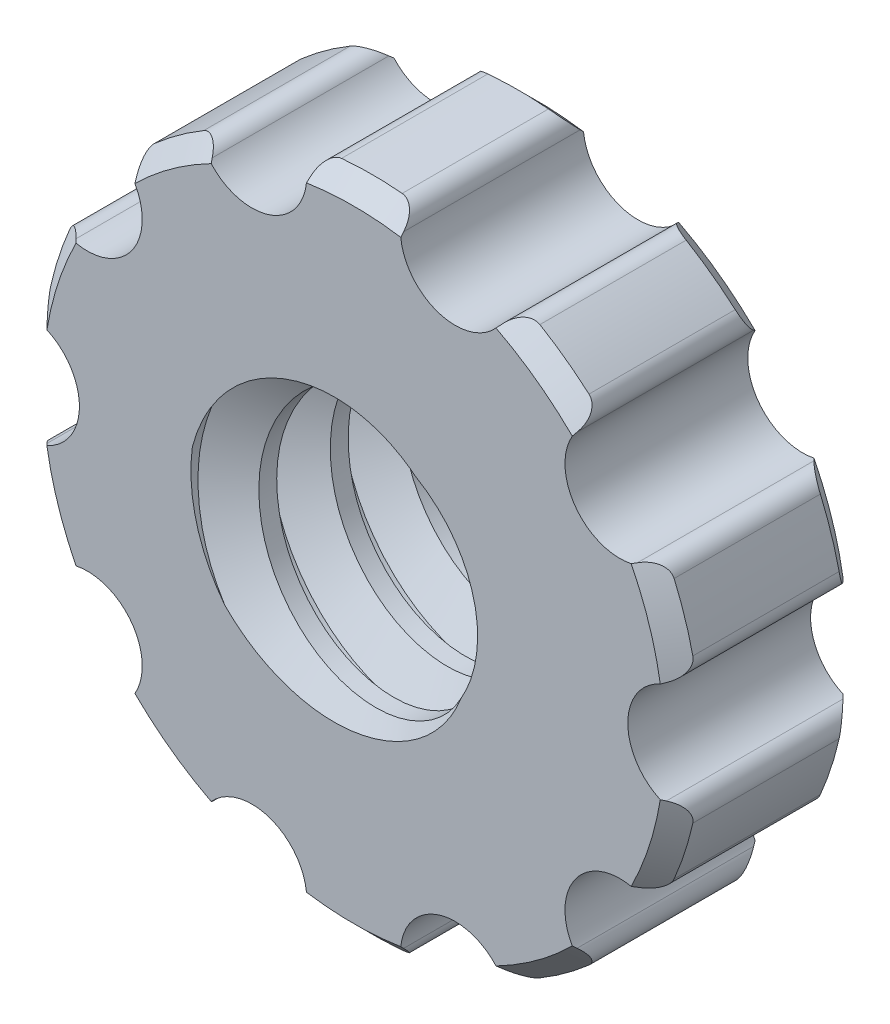
from build123d import *

# Parameters (mm, degrees)
SKETCH1_R                = 9
SKETCH1_R_2              = 4.45
BOSS_EXTRUDE1_DEPTH      = 5
THREAD1_PITCH            = 1.953846154
SKETCH4_R                = 9.464678692
CUT_EXTRUDE1_DEPTH       = 6
SKETCH5_R                = 9.464678692
CUT_EXTRUDE2_DEPTH       = 6
CHAMFER1_SIZE            = 0.5
SKETCH6_R                = 1.5
CUT_EXTRUDE3_DEPTH       = 14.674794368
FILLET1_R                = 0.5
CIRPATTERN1_COUNT        = 10
FILLET1_OF_CIRPATTERN1_R = 0.5


with BuildPart() as part:
    # Sketch1 → Boss-Extrude1 (new body)
    with BuildSketch(Plane.XY):
        Circle(SKETCH1_R)
        Circle(SKETCH1_R_2, mode=Mode.SUBTRACT)
    extrude(amount=BOSS_EXTRUDE1_DEPTH)

    # Thread1: the profile of Thread Profile1 profile screwed along a right-hand helix of 5.5 turns, 10 arcs to a turn; built about Z, then put on its axis
    thread1_z = Axis((0, 0, 0), (0, 0, 1))
    thread1_corners = [(4.4503, 0, -0.000173205), (4.4503, 0, 1.709788584), (3.392449752, 0, 1.099038459), (3.392449752, 0, 0.61057692)]
    with BuildLine(mode=Mode.PRIVATE) as thread1_profile:
        Line(thread1_corners[0], thread1_corners[1])
        Line(thread1_corners[1], thread1_corners[2])
        Line(thread1_corners[2], thread1_corners[3])
        Line(thread1_corners[3], thread1_corners[0])
    thread1_cap = Face(thread1_profile.wire())
    thread1_turn_angles = [0, 18, 36, 54, 72, 90, 108, 126, 144, 162, 180, 198, 216, 234, 252, 270, 288, 306, 324, 342, 360]
    thread1_turn_weights = [1, 0.9510565162951535, 1, 0.9510565162951535, 1, 0.9510565162951535, 1, 0.9510565162951535, 1, 0.9510565162951535, 1, 0.9510565162951535, 1, 0.9510565162951535, 1, 0.9510565162951535, 1, 0.9510565162951535, 1, 0.9510565162951535, 1]
    thread1_turn_rails = [Edge.make_bspline([Vector(p[0], p[1], 0).rotate(thread1_z, thread1_turn_angles[k]) / thread1_turn_weights[k] + Vector(0, 0, p[2] + THREAD1_PITCH * thread1_turn_angles[k] / 360) for k in range(21)], [0, 0, 0, 1, 1, 2, 2, 3, 3, 4, 4, 5, 5, 6, 6, 7, 7, 8, 8, 9, 9, 10, 10, 10], 2, thread1_turn_weights) for p in thread1_corners]
    thread1_turn_sides = [Face.make_surface_from_curves(thread1_turn_rails[p[0]], thread1_turn_rails[p[1]]) for p in [(0, 1), (1, 2), (2, 3), (3, 0)]]
    thread1_last_angles = [1800, 1818, 1836, 1854, 1872, 1890, 1908, 1926, 1944, 1962, 1980]
    thread1_last_weights = [1, 0.9510565162951535, 1, 0.9510565162951535, 1, 0.9510565162951535, 1, 0.9510565162951535, 1, 0.9510565162951535, 1]
    thread1_last_rails = [Edge.make_bspline([Vector(p[0], p[1], 0).rotate(thread1_z, thread1_last_angles[k]) / thread1_last_weights[k] + Vector(0, 0, p[2] + THREAD1_PITCH * thread1_last_angles[k] / 360) for k in range(11)], [0, 0, 0, 1, 1, 2, 2, 3, 3, 4, 4, 5, 5, 5], 2, thread1_last_weights) for p in thread1_corners]
    thread1_last_sides = [Face.make_surface_from_curves(thread1_last_rails[p[0]], thread1_last_rails[p[1]]) for p in [(0, 1), (1, 2), (2, 3), (3, 0)]]
    thread1 = Plane(origin=(0, 0, 6.75), x_dir=(-1, 0, 0), z_dir=(0, 0, -1)) * Solid(Shell([*[p.moved(Location((0, 0, THREAD1_PITCH * i))) for i in range(5) for p in thread1_turn_sides], *thread1_last_sides, thread1_cap, thread1_cap.rotate(thread1_z, 1980).moved(Location((0, 0, THREAD1_PITCH * 1980 / 360)))]))
    add(thread1)

    # Sketch4 → Cut-Extrude1 (cut)
    with BuildSketch(Plane(origin=(0, 0, 0), x_dir=(-1, 0, 0), z_dir=(0, 0, -1))):
        Circle(SKETCH4_R)
    extrude(amount=CUT_EXTRUDE1_DEPTH, mode=Mode.SUBTRACT)

    # Sketch5 → Cut-Extrude2 (cut)
    with BuildSketch(Plane.XY.offset(5)):
        Circle(SKETCH5_R)
    extrude(amount=CUT_EXTRUDE2_DEPTH, mode=Mode.SUBTRACT)

    # Chamfer1
    chamfer1_edges = [part.edges().sort_by_distance(p)[0] for p in [
        (-9, 0, 0),
        (-9, 0, 5),
    ]]
    chamfer(chamfer1_edges, length=CHAMFER1_SIZE)

    # Sketch6 → Cut-Extrude3 (cut, through all)
    with BuildSketch(Plane.XY.offset(5)):
        with Locations((-9, 0)):
            Circle(SKETCH6_R)
    cut_extrude3 = extrude(amount=-CUT_EXTRUDE3_DEPTH, mode=Mode.SUBTRACT)

    # Fillet1
    fillet1_edges = [part.edges().sort_by_distance(p)[0] for p in [
        (-8.875, 1.494782593, 2.5),
        (-8.875, -1.494782593, 2.5),
    ]]
    fillet(fillet1_edges, radius=FILLET1_R)

    # CirPattern1: Cut-Extrude3 ×10 about axis
    cirpattern1_axis = Axis((0, 0, 0), (0, 0, 1))
    for i in range(1, CIRPATTERN1_COUNT):
        add(cut_extrude3.rotate(cirpattern1_axis, i * 360 / CIRPATTERN1_COUNT), mode=Mode.SUBTRACT)

    # Fillet1 of CirPattern1
    fillet1_of_cirpattern1_edges = [part.edges().sort_by_distance(p)[0] for p in [
        (-8.058636989, -4.007289594, 2.5),
        (-6.301414662, -6.425898635, 2.5),
        (-4.16414855, -7.978713358, 2.5),
        (-1.3209031, -8.902539806, 2.5),
        (1.3209031, -8.902539806, 2.5),
        (4.16414855, -7.978713358, 2.5),
        (6.301414662, -6.425898635, 2.5),
        (8.058636989, -4.007289594, 2.5),
        (8.875, -1.494782593, 2.5),
        (8.875, 1.494782593, 2.5),
        (8.058636989, 4.007289594, 2.5),
        (6.301414662, 6.425898635, 2.5),
        (4.16414855, 7.978713358, 2.5),
        (1.3209031, 8.902539806, 2.5),
        (-1.3209031, 8.902539806, 2.5),
        (-4.16414855, 7.978713358, 2.5),
        (-6.301414662, 6.425898635, 2.5),
        (-8.058636989, 4.007289594, 2.5),
    ]]
    fillet(fillet1_of_cirpattern1_edges, radius=FILLET1_OF_CIRPATTERN1_R)


solid = part.part
